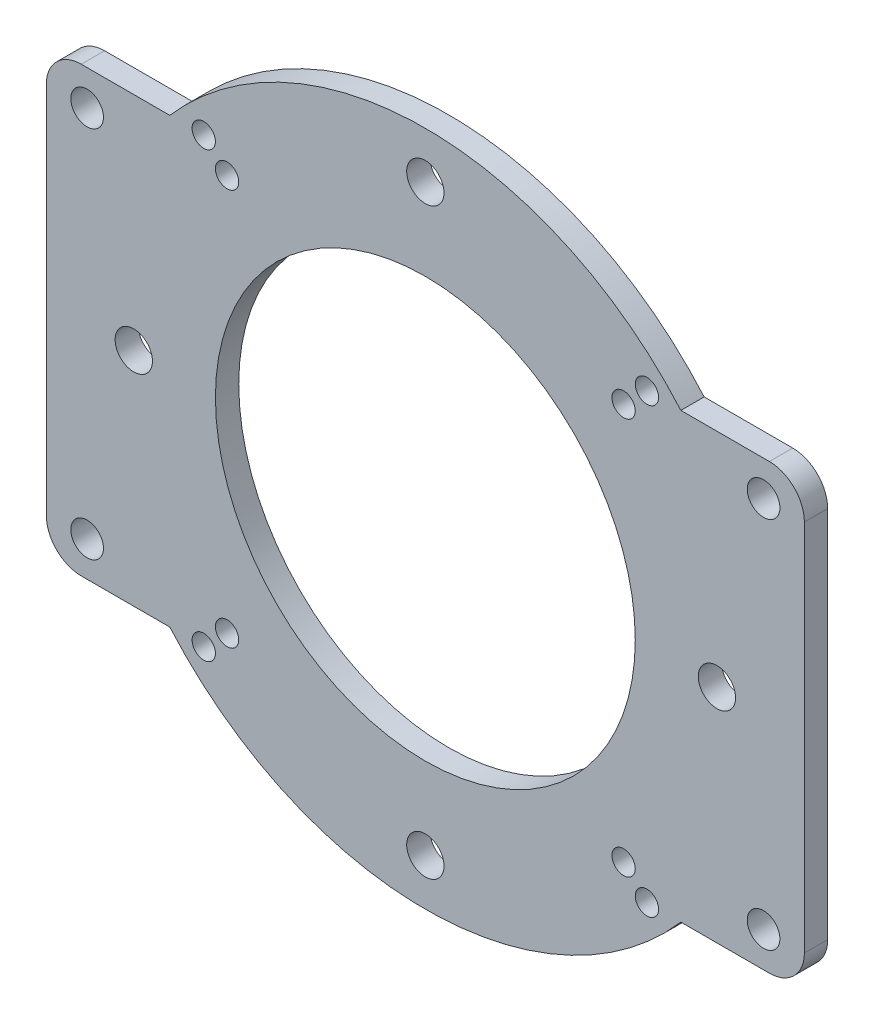
from build123d import *

# Parameters (mm, degrees)
SKETCH1_R             = 18
BOSS_EXTRUDE1_DEPTH   = 2
SKETCH2_R             = 1.4
CUT_EXTRUDE1_DEPTH    = 2
F_2_0MM_DOWEL_HOLE1_D = 2
SKETCH5_R             = 1.6
CUT_EXTRUDE4_DEPTH    = 44.603325561
FILLET1_R             = 3


with BuildPart() as part:
    # Sketch1 → Boss-Extrude1 (new body)
    with BuildSketch(Plane.XY):
        with BuildLine():
            Line((-32.5, 19), (-21.9089023, 19))
            ThreePointArc((-21.9089023, 19), (0, 29), (21.9089023, 19))
            Line((21.9089023, 19), (32.5, 19))
            Line((32.5, 19), (32.5, -19))
            Line((32.5, -19), (21.9089023, -19))
            ThreePointArc((21.9089023, -19), (0, -29), (-21.9089023, -19))
            Line((-21.9089023, -19), (-32.5, -19))
            Line((-32.5, -19), (-32.5, 19))
        make_face()
        Circle(SKETCH1_R, mode=Mode.SUBTRACT)
    extrude(amount=BOSS_EXTRUDE1_DEPTH)

    # Sketch2 → Cut-Extrude1 (cut)
    with BuildSketch(Plane.XY.offset(2)):
        with Locations((-29, 16)):
            Circle(SKETCH2_R)
        with Locations((-29, -16)):
            Circle(SKETCH2_R)
        with Locations((29, -16)):
            Circle(SKETCH2_R)
        with Locations((29, 16)):
            Circle(SKETCH2_R)
    extrude(amount=-CUT_EXTRUDE1_DEPTH, mode=Mode.SUBTRACT)

    # Ø2.0mm Dowel Hole1 (through all)
    with Locations(Plane(origin=(-19, 19, 2), x_dir=(1, 0, 0), z_dir=(0, 0, 1))):
        with Locations((0, 0), (2, -2), (36, -2), (38, 0), (36, -36), (38, -38), (0, -38), (2, -36)):
            Hole(F_2_0MM_DOWEL_HOLE1_D / 2)

    # Sketch5 → Cut-Extrude4 (cut, through all)
    with BuildSketch(Plane.XY):
        with Locations((0, 25)):
            Circle(SKETCH5_R)
        with Locations((-25, 0)):
            Circle(SKETCH5_R)
        with Locations((25, 0)):
            Circle(SKETCH5_R)
        with Locations((0, -25)):
            Circle(SKETCH5_R)
    extrude(amount=CUT_EXTRUDE4_DEPTH, mode=Mode.SUBTRACT)

    # Fillet1
    fillet1_edges = [part.edges().sort_by_distance(p)[0] for p in [
        (-32.5, -19, 1),
        (-32.5, 19, 1),
        (32.5, 19, 1),
        (32.5, -19, 1),
    ]]
    fillet(fillet1_edges, radius=FILLET1_R)


solid = part.part
